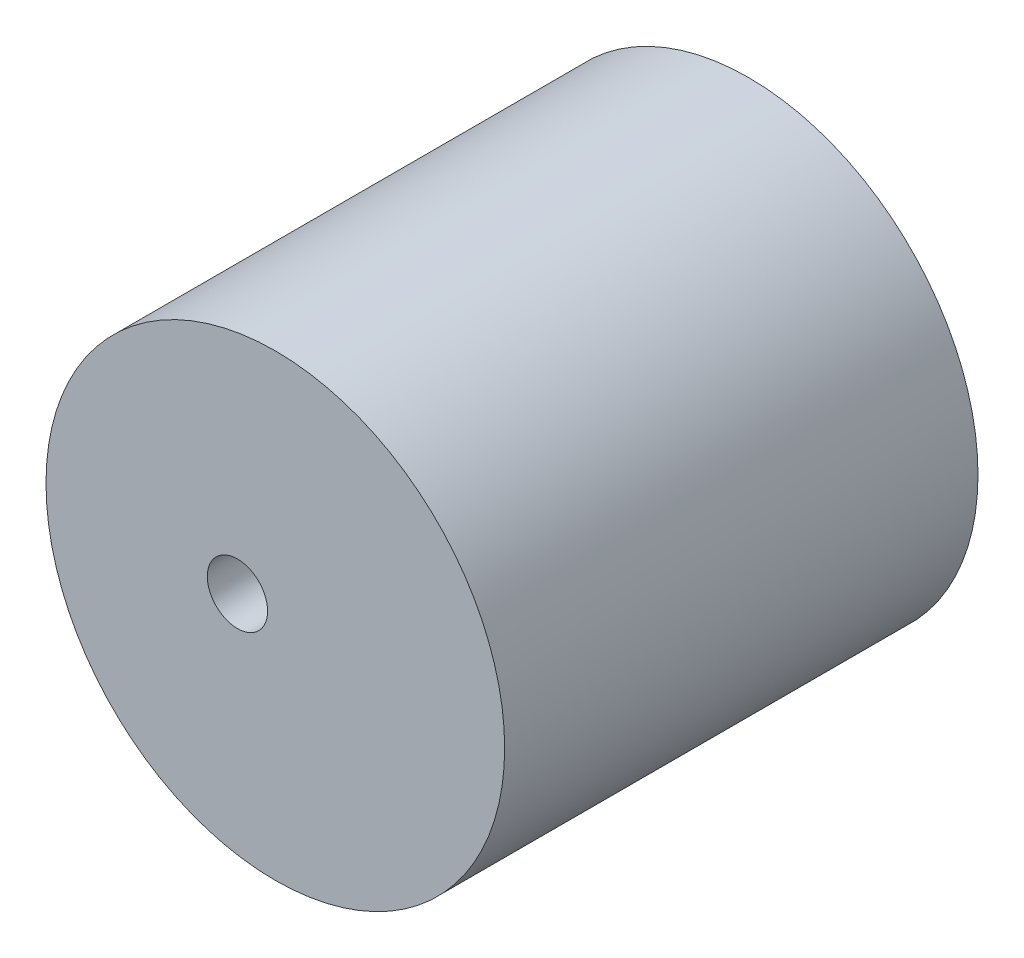
from build123d import *

# Parameters (mm, degrees)
SKETCH1_R            = 24.225
SKETCH1_R_2          = 3.185
BOSS_EXTRUDE5_DEPTH  = 50
SKETCH6_R            = 23.453125
SKETCH6_R_2          = 3.290625
BOSS_EXTRUDE9_DEPTH  = 2
SKETCH7_R            = 24.165625
SKETCH7_R_2          = 3.306875
BOSS_EXTRUDE10_DEPTH = 2


with BuildPart() as part:
    # Sketch1 → Boss-Extrude5 (new body)
    with BuildSketch(Plane.XY):
        Circle(SKETCH1_R)
        with Locations((-4, 0)):
            Circle(SKETCH1_R_2, mode=Mode.SUBTRACT)
    extrude(amount=BOSS_EXTRUDE5_DEPTH)

    # Sketch6 → Boss-Extrude9 (add)
    with BuildSketch(Plane.XY):
        Circle(SKETCH6_R)
        with Locations((-4, 0)):
            Circle(SKETCH6_R_2, mode=Mode.SUBTRACT)
    extrude(amount=BOSS_EXTRUDE9_DEPTH)

    # Sketch7 → Boss-Extrude10 (add)
    with BuildSketch(Plane.XY):
        Circle(SKETCH7_R)
        with Locations((-4, 0)):
            Circle(SKETCH7_R_2, mode=Mode.SUBTRACT)
    extrude(amount=BOSS_EXTRUDE10_DEPTH)


solid = part.part
